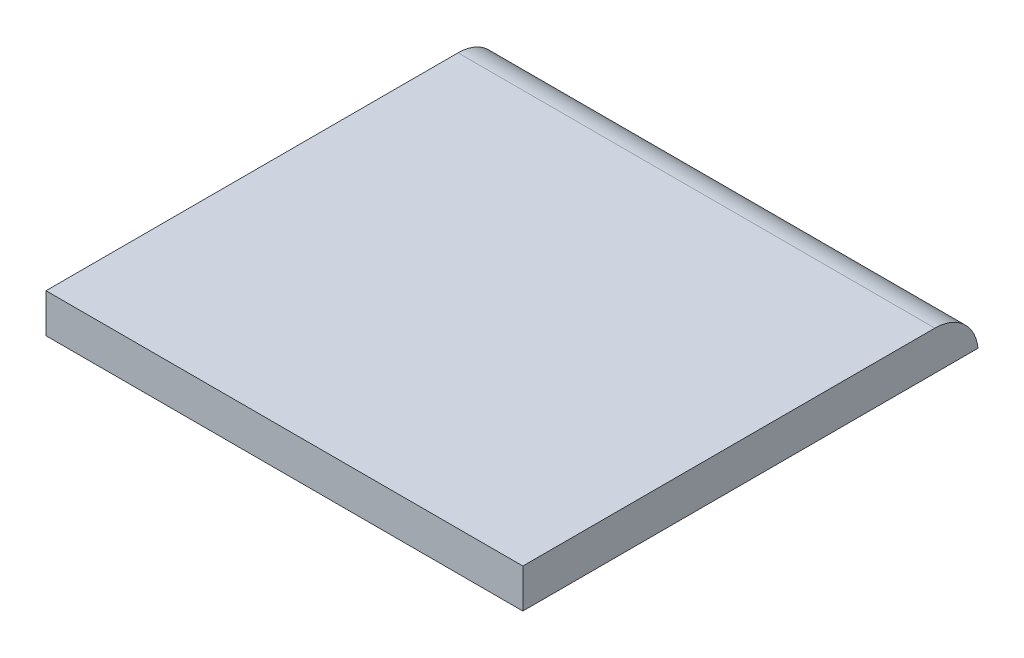
from build123d import *

# Parameters (mm, degrees)
ESQUISSE1_W        = 105
ESQUISSE1_H        = 9
BOSS_EXTRU_1_DEPTH = 110
CONG_1_R           = 10


with BuildPart() as part:
    # Esquisse1 → Boss.-Extru.1 (new body)
    with BuildSketch(Plane(origin=(0, 0, 0), x_dir=(0, 0, -1), z_dir=(1, 0, 0))):
        with Locations((52.5, 4.5)):
            Rectangle(ESQUISSE1_W, ESQUISSE1_H)
    extrude(amount=BOSS_EXTRU_1_DEPTH)

    # Congé1
    # the kernel refuses this fillet: 10 mm, written as the material it takes off along each edge
    with BuildSketch(Plane(origin=(-24.874685928, 9, -105), x_dir=(0, -1, 0), z_dir=(1, 0, 0))) as cong_1_piece_1:
        with BuildLine():
            CenterArc((10, -9.949874371), CONG_1_R, 95.739170477, 84.260829523)
            Line((0, -9.949874371), (-0.2, -9.949874371))
            Line((-0.2, -9.949874371), (-0.2, 0))
            Line((-0.2, 0), (0, 0.2))
            ThreePointArc((0, 0.2), (4.5, 0.2), (8.98, 0.198997487))
            Line((8.98, 0.198997487), (9, 0))
        make_face()
    extrude(amount=159.749371855, mode=Mode.SUBTRACT)


solid = part.part
